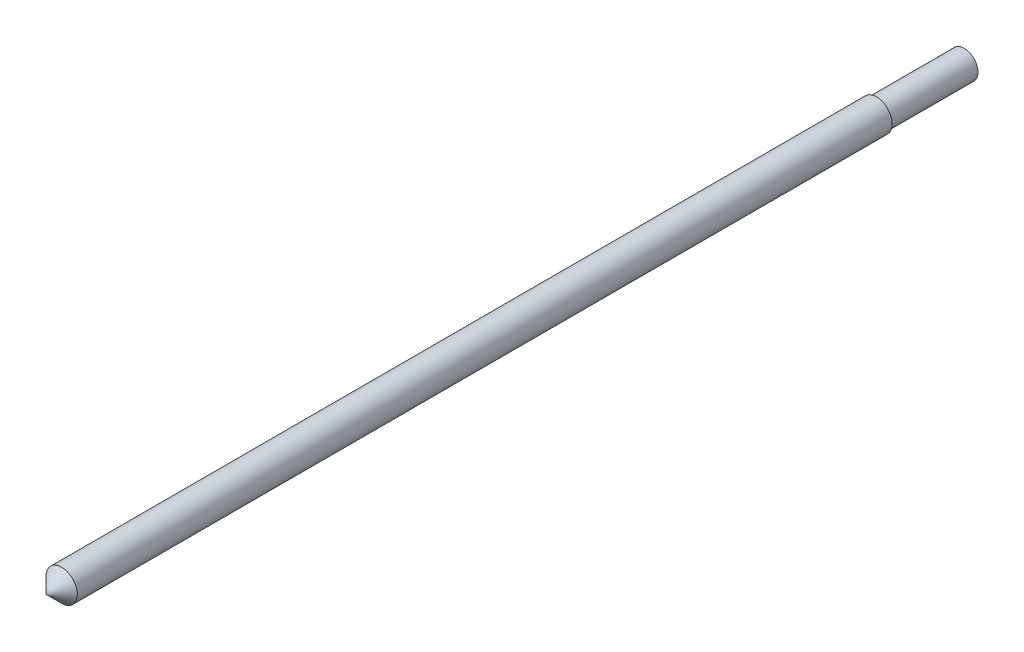
from build123d import *

# Parameters (mm, degrees)
SKETCH1_R           = 12.5
BOSS_EXTRUDE1_DEPTH = 650
SKETCH3_R           = 11
BOSS_EXTRUDE2_DEPTH = 70


with BuildPart() as part:
    # Sketch1 → Boss-Extrude1 (new body)
    with BuildSketch(Plane.XY):
        Circle(SKETCH1_R)
    extrude(amount=BOSS_EXTRUDE1_DEPTH)

    # Sketch2 → Revolve1 (revolve)
    with BuildSketch(Plane(origin=(0, 0, 0), x_dir=(1, 0, 0), z_dir=(0, 1, 0))):
        Polygon((0, -650), (0, -662.5), (12.5, -650), align=None)
    revolve(axis=Axis((0, 0, 650), (0, 0, 1)))

    # Sketch3 → Boss-Extrude2 (add)
    with BuildSketch(Plane(origin=(0, 0, 0), x_dir=(-1, 0, 0), z_dir=(0, 0, -1))):
        Circle(SKETCH3_R)
    extrude(amount=BOSS_EXTRUDE2_DEPTH)


solid = part.part
